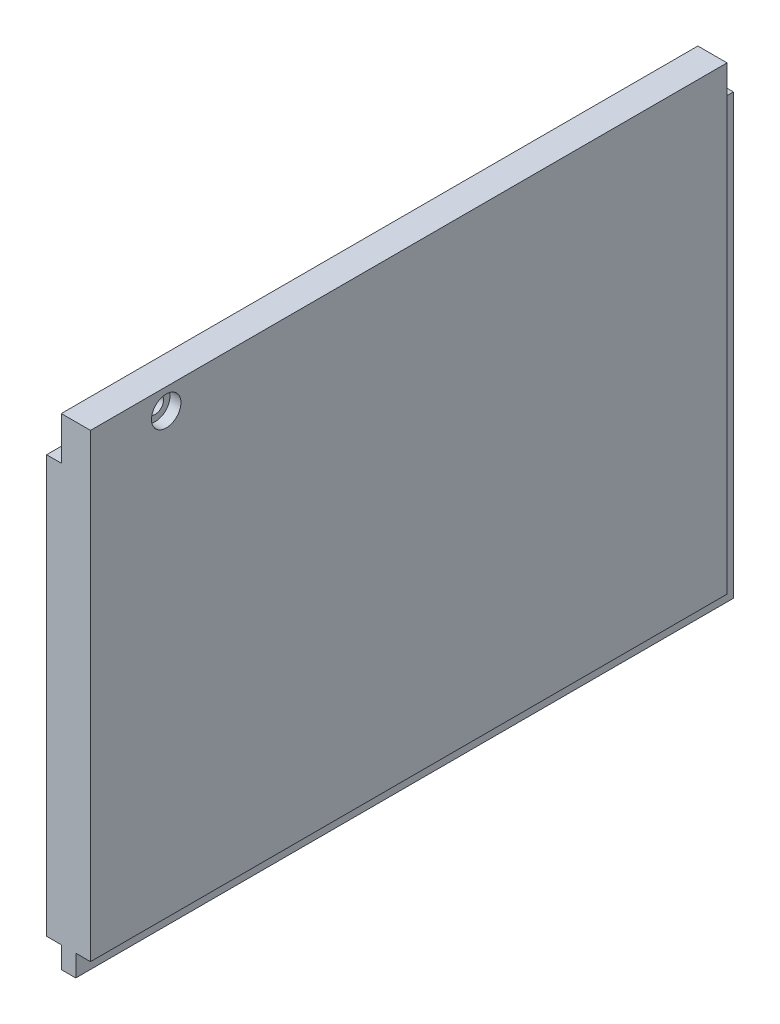
from build123d import *
from OCP.BRepFilletAPI import BRepFilletAPI_MakeChamfer

# Parameters (mm, degrees)
SKETCH1_W           = 95
SKETCH1_H           = 145
BOSS_EXTRUDE1_DEPTH = 10
SKETCH2_W           = 3.3
SKETCH2_H           = 4.8
BOSS_EXTRUDE2_DEPTH = 95
SKETCH3_W           = 3.3
SKETCH3_H           = 149.8
BOSS_EXTRUDE3_DEPTH = 4.9
BOSS_EXTRUDE4_DEPTH = 10
CUT_EXTRUDE1_REACH  = 181.304
SKETCH5_R           = 1.9
SKETCH6_R           = 3.35
CUT_EXTRUDE2_DEPTH  = 2.5
CUT_EXTRUDE3_REACH  = 181.304
SKETCH7_W           = 0.2
SKETCH7_H           = 145
SKETCH8_W           = 85
SKETCH8_H           = 135
CUT_EXTRUDE4_DEPTH  = 5
CHAMFER1_SIZE       = 2.5
CHAMFER1_SIZE_2     = 5


with BuildPart() as part:
    # Sketch1 → Boss-Extrude1 (new body)
    with BuildSketch(Plane.YZ):
        with Locations((47.5, 72.5)):
            Rectangle(SKETCH1_W, SKETCH1_H)
    extrude(amount=-BOSS_EXTRUDE1_DEPTH)

    # Sketch2 → Boss-Extrude2 (add)
    with BuildSketch(Plane.XZ):
        with Locations((-5, -2.4)):
            Rectangle(SKETCH2_W, SKETCH2_H)
    extrude(amount=-BOSS_EXTRUDE2_DEPTH)

    # Sketch3 → Boss-Extrude3 (add)
    with BuildSketch(Plane.XZ):
        with Locations((-5, 70.1)):
            Rectangle(SKETCH3_W, SKETCH3_H)
    extrude(amount=BOSS_EXTRUDE3_DEPTH)

    # Sketch4 → Boss-Extrude4 (add)
    with BuildSketch(Plane(origin=(0, 95, 0), x_dir=(-1, 0, 0), z_dir=(0, 1, 0))):
        Polygon((6.65, 145), (0, 145), (0, 0), (3.35, 0), (6.65, 0), align=None)
    extrude(amount=BOSS_EXTRUDE4_DEPTH)

    # Sketch5 → Cut-Extrude1 (cut, up to next)
    with BuildSketch(Plane.YZ, mode=Mode.PRIVATE) as cut_extrude1_sk1:
        with Locations(Location((100, 127.75, 0), (0, 0, 270))):
            Circle(SKETCH5_R)
    cut_extrude1_tool1 = extrude(cut_extrude1_sk1.sketch, amount=-CUT_EXTRUDE1_REACH, mode=Mode.PRIVATE) & part.part
    add(cut_extrude1_tool1.solids().sort_by_distance((0, 100, 127.75))[0], mode=Mode.SUBTRACT)

    # Sketch6 → Cut-Extrude2 (cut)
    with BuildSketch(Plane.YZ):
        with Locations(Location((100, 127.75, 0), (0, 0, 270))):
            Circle(SKETCH6_R)
    extrude(amount=-CUT_EXTRUDE2_DEPTH, mode=Mode.SUBTRACT)

    # Sketch7 → Cut-Extrude3 (cut, up to next)
    with BuildSketch(Plane.YZ, mode=Mode.PRIVATE) as cut_extrude3_sk1:
        with Locations((104.9, 72.5)):
            Rectangle(SKETCH7_W, SKETCH7_H)
    cut_extrude3_tool1 = extrude(cut_extrude3_sk1.sketch, amount=-CUT_EXTRUDE3_REACH, mode=Mode.PRIVATE) & part.part
    add(cut_extrude3_tool1.solids().sort_by_distance((0, 104.9, 72.5))[0], mode=Mode.SUBTRACT)

    # Sketch8 → Cut-Extrude4 (cut)
    with BuildSketch(Plane(origin=(-10, 0, 0), x_dir=(0, -1, 0), z_dir=(-1, 0, 0))):
        with Locations((-47.5, 72.5)):
            Rectangle(SKETCH8_W, SKETCH8_H)
    extrude(amount=-CUT_EXTRUDE4_DEPTH, mode=Mode.SUBTRACT)

    # Chamfer1
    chamfer1_edges_1 = [part.edges().sort_by_distance(p)[0] for p in [
        (-10, 5, 72.5),
    ]]
    chamfer1_side_1 = [part.faces().sort_by_distance(p)[0] for p in [
        (-10, 4.95, 72.5),
    ]]
    chamfer1_edges_2 = [part.edges().sort_by_distance(p)[0] for p in [
        (-10, 47.5, 5),
    ]]
    chamfer1_side_2 = [part.faces().sort_by_distance(p)[0] for p in [
        (-10, 47.5, 4.95),
    ]]
    chamfer1_edges_3 = [part.edges().sort_by_distance(p)[0] for p in [
        (-10, 90, 72.5),
    ]]
    chamfer1_side_3 = [part.faces().sort_by_distance(p)[0] for p in [
        (-10, 90.05, 72.5),
    ]]
    chamfer1_edges_4 = [part.edges().sort_by_distance(p)[0] for p in [
        (-10, 47.5, 140),
    ]]
    chamfer1_side_4 = [part.faces().sort_by_distance(p)[0] for p in [
        (-10, 47.5, 140.05),
    ]]
    chamfer1 = BRepFilletAPI_MakeChamfer(part.part.solid().wrapped)
    for e in chamfer1_edges_1:
        chamfer1.Add(CHAMFER1_SIZE - 0.0001, CHAMFER1_SIZE_2 - 0.0001, e.wrapped, chamfer1_side_1[0].wrapped)
    for e in chamfer1_edges_2:
        chamfer1.Add(CHAMFER1_SIZE - 0.0001, CHAMFER1_SIZE_2 - 0.0001, e.wrapped, chamfer1_side_2[0].wrapped)
    for e in chamfer1_edges_3:
        chamfer1.Add(CHAMFER1_SIZE - 0.0001, CHAMFER1_SIZE_2 - 0.0001, e.wrapped, chamfer1_side_3[0].wrapped)
    for e in chamfer1_edges_4:
        chamfer1.Add(CHAMFER1_SIZE - 0.0001, CHAMFER1_SIZE_2 - 0.0001, e.wrapped, chamfer1_side_4[0].wrapped)
    add(Compound.cast(chamfer1.Shape()), mode=Mode.REPLACE)  # a hair under: the kernel refuses the full size


solid = part.part
